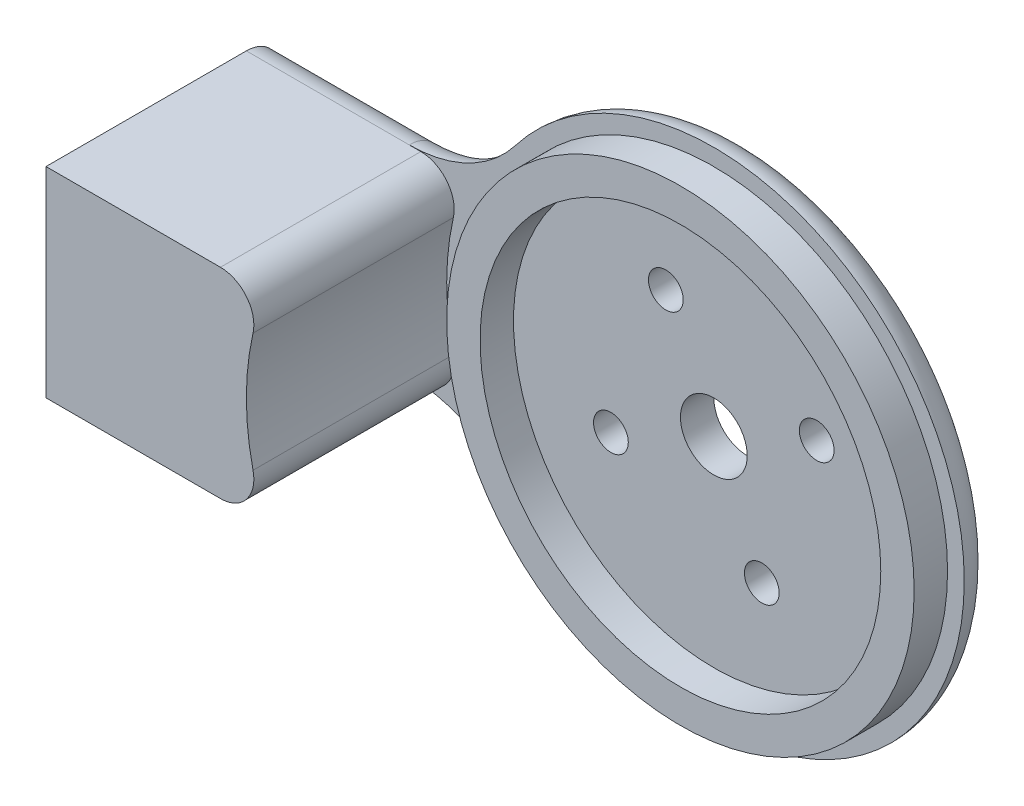
from build123d import *

# Parameters (mm, degrees)
ESQUISSE1_R             = 5
BOSS_EXTRU_1_DEPTH      = 5
ESQUISSE6_R             = 35
ESQUISSE6_R_2           = 30
BOSS_EXTRU_6_DEPTH      = 5
BOSS_EXTRU_9_DEPTH      = 30
CONG_3_R                = 5
ESQUISSE10_R            = 2.6
ENL_V_MAT_EXTRU_1_DEPTH = 87.782774789


with BuildPart() as part:
    # Esquisse1 → Boss.-Extru.1 (new body)
    with BuildSketch(Plane.XY):
        with BuildLine():
            Line((-45.620718977, 15), (-70, 15))
            Line((-70, 15), (-70, -15))
            Line((-70, -15), (-45.620718977, -15))
            ThreePointArc((-45.620718977, -15), (-36.774201608, -17.062911874), (-29.752642811, -22.826086957))
            ThreePointArc((-29.752642811, -22.826086957), (37.5, 0), (-29.752642811, 22.826086957))
            ThreePointArc((-29.752642811, 22.826086957), (-36.774201608, 17.062911874), (-45.620718977, 15))
        make_face()
        Circle(ESQUISSE1_R, mode=Mode.SUBTRACT)
    extrude(amount=BOSS_EXTRU_1_DEPTH)

    # Esquisse6 → Boss.-Extru.6 (add)
    with BuildSketch(Plane.XY.offset(5)):
        Circle(ESQUISSE6_R)
        Circle(ESQUISSE6_R_2, mode=Mode.SUBTRACT)
    extrude(amount=BOSS_EXTRU_6_DEPTH)

    # Esquisse8 → Boss.-Extru.9 (add)
    with BuildSketch(Plane.XY.offset(5)):
        with BuildLine():
            Line((-70, -15), (-70, 15))
            Line((-70, 15), (-43.874821937, 15))
            ThreePointArc((-43.874821937, 15), (-39.966142137, 13.118047822), (-38.999841722, 8.888888889))
            ThreePointArc((-38.999841722, 8.888888889), (-40, 0), (-38.999841722, -8.888888889))
            ThreePointArc((-38.999841722, -8.888888889), (-39.966142137, -13.118047822), (-43.874821937, -15))
            Line((-43.874821937, -15), (-70, -15))
        make_face()
    extrude(amount=BOSS_EXTRU_9_DEPTH)

    # Congé3
    cong_3_edges = [part.edges().sort_by_distance(p)[0] for p in [
        (37.5, 0, 0),
        (-57.810359489, 15, 0),
        (-57.810359489, -15, 0),
        (-36.774201608, -17.062911874, 0),
        (-36.774201608, 17.062911874, 0),
    ]]
    fillet(cong_3_edges, radius=CONG_3_R - 0.0001)  # a hair under: the kernel refuses the full size

    # Esquisse10 → Enlèv. mat.-Extru.1 (cut, through all)
    with BuildSketch(Plane(origin=(0, 0, 0), x_dir=(-1, 0, 0), z_dir=(0, 0, -1))):
        with Locations((-15.40723238, 7.18451045)):
            Circle(ESQUISSE10_R)
        with Locations((7.18451045, 15.40723238)):
            Circle(ESQUISSE10_R)
        with Locations((15.40723238, -7.18451045)):
            Circle(ESQUISSE10_R)
        with Locations((-7.18451045, -15.40723238)):
            Circle(ESQUISSE10_R)
    extrude(amount=-ENL_V_MAT_EXTRU_1_DEPTH, mode=Mode.SUBTRACT)


solid = part.part
